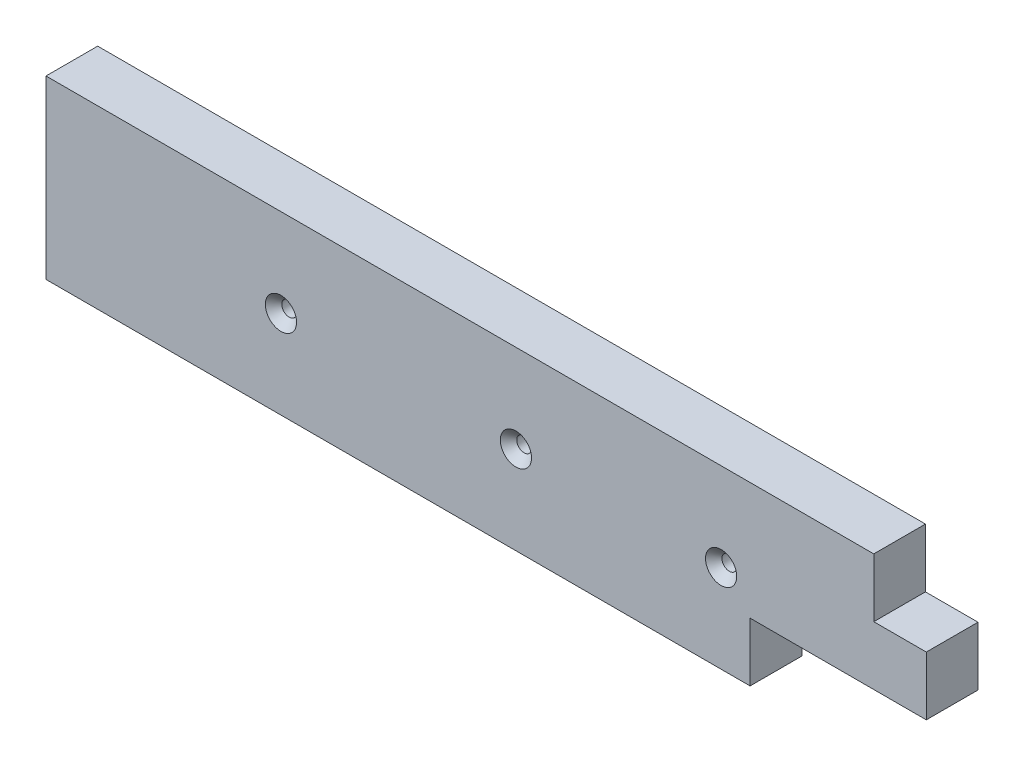
from build123d import *

# Parameters (mm, degrees)
SKETCH1_W                                            = 380.651745172
SKETCH1_H                                            = 22.352
BOSS_EXTRUDE1_DEPTH                                  = 38.1
CSK_FOR_M6_HEX_SOCKET_COUNTERSUNK_HEAD_S_D           = 6.4
CSK_FOR_M6_HEX_SOCKET_COUNTERSUNK_HEAD_S_CSINK_D     = 13.5
CSK_FOR_M6_HEX_SOCKET_COUNTERSUNK_HEAD_S_CSINK_ANGLE = 90
CSK_FOR_M6_HEX_SOCKET_COUNTERSUNK_HE_2_D             = 6.4
CSK_FOR_M6_HEX_SOCKET_COUNTERSUNK_HE_2_CSINK_D       = 13.5
CSK_FOR_M6_HEX_SOCKET_COUNTERSUNK_HE_2_CSINK_ANGLE   = 90
CSK_FOR_M6_HEX_SOCKET_COUNTERSUNK_HE_3_D             = 6.4
CSK_FOR_M6_HEX_SOCKET_COUNTERSUNK_HE_3_CSINK_D       = 13.5
CSK_FOR_M6_HEX_SOCKET_COUNTERSUNK_HE_3_CSINK_ANGLE   = 90
SKETCH3_W                                            = 22.71951641
SKETCH3_H                                            = 25.4
SKETCH3_W_2                                          = 76.2
CUT_EXTRUDE1_DEPTH                                   = 196.384645455


with BuildPart() as part:
    # Sketch1 → Boss-Extrude1 (new, symmetric)
    with BuildSketch(Plane(origin=(0, 0, 0), x_dir=(1, 0, 0), z_dir=(0, 1, 0))):
        Rectangle(SKETCH1_W, SKETCH1_H)
    extrude(amount=BOSS_EXTRUDE1_DEPTH, both=True)

    # CSK for M6 Hex Socket Countersunk Head S (through all)
    with Locations(Plane.XY.offset(11.176)):
        with Locations((-88.725872586, 0)):
            CounterSinkHole(CSK_FOR_M6_HEX_SOCKET_COUNTERSUNK_HEAD_S_D / 2, CSK_FOR_M6_HEX_SOCKET_COUNTERSUNK_HEAD_S_CSINK_D / 2, counter_sink_angle=CSK_FOR_M6_HEX_SOCKET_COUNTERSUNK_HEAD_S_CSINK_ANGLE)

    # CSK for M6 Hex Socket Countersunk He 2 (through all)
    with Locations(Plane.XY.offset(11.176)):
        with Locations((12.874127414, 0)):
            CounterSinkHole(CSK_FOR_M6_HEX_SOCKET_COUNTERSUNK_HE_2_D / 2, CSK_FOR_M6_HEX_SOCKET_COUNTERSUNK_HE_2_CSINK_D / 2, counter_sink_angle=CSK_FOR_M6_HEX_SOCKET_COUNTERSUNK_HE_2_CSINK_ANGLE)

    # CSK for M6 Hex Socket Countersunk He 3 (through all)
    with Locations(Plane.XY.offset(11.176)):
        with Locations((101.6, 0)):
            CounterSinkHole(CSK_FOR_M6_HEX_SOCKET_COUNTERSUNK_HE_3_D / 2, CSK_FOR_M6_HEX_SOCKET_COUNTERSUNK_HE_3_CSINK_D / 2, counter_sink_angle=CSK_FOR_M6_HEX_SOCKET_COUNTERSUNK_HE_3_CSINK_ANGLE)

    # Sketch3 → Cut-Extrude1 (cut, through all)
    with BuildSketch(Plane.XY.offset(11.176)):
        with Locations((178.966114381, 25.4)):
            Rectangle(SKETCH3_W, SKETCH3_H)
        with Locations((152.225872586, -25.4)):
            Rectangle(SKETCH3_W_2, SKETCH3_H)
    extrude(amount=-CUT_EXTRUDE1_DEPTH, mode=Mode.SUBTRACT)


solid = part.part
